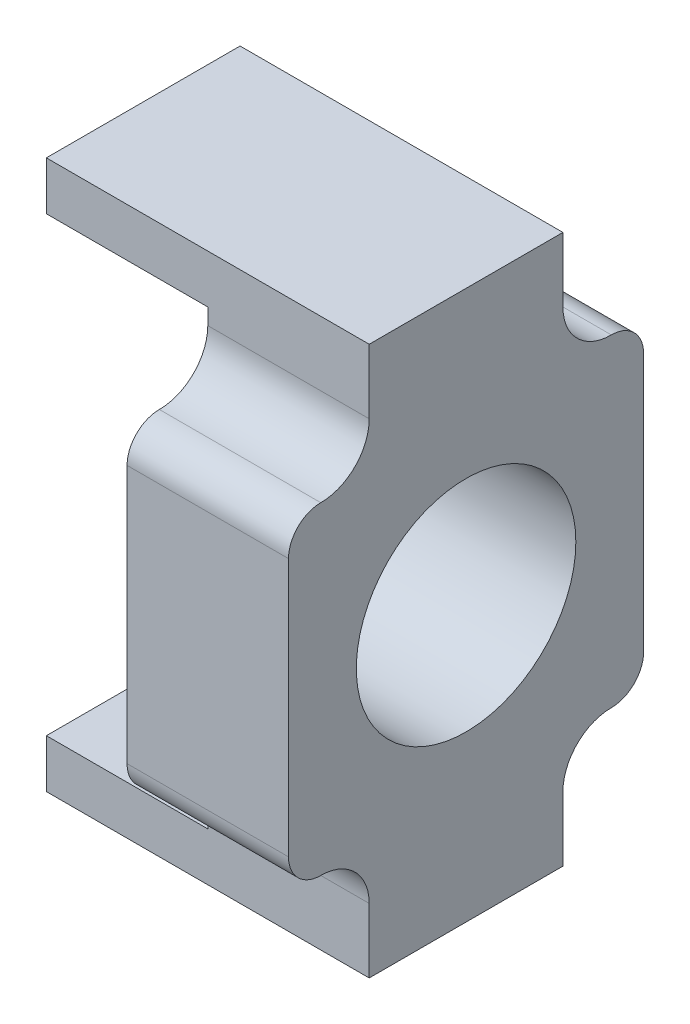
from build123d import *

# Parameters (mm, degrees)
SKETCH1_R           = 3.4
BOSS_EXTRUDE1_DEPTH = 5
SKETCH3_W           = 6
SKETCH3_H           = 1.5
BOSS_EXTRUDE2_DEPTH = 5
FILLET2_R           = 1.5
FILLET3_R           = 1


with BuildPart() as part:
    # Sketch1 → Boss-Extrude1 (new body)
    with BuildSketch(Plane(origin=(0, 0, 0), x_dir=(0, 0, -1), z_dir=(1, 0, 0))):
        Polygon((2.5, 0), (8.5, 0), (8.5, 3.5), (11, 3.5), (11, 13.5), (8.5, 13.5), (8.5, 17), (2.5, 17), (2.5, 13.5), (0, 13.5), (0, 3.5), (2.5, 3.5), align=None)
        with Locations((5.5, 8.5)):
            Circle(SKETCH1_R, mode=Mode.SUBTRACT)
    extrude(amount=BOSS_EXTRUDE1_DEPTH)

    # Sketch3 → Boss-Extrude2 (add)
    with BuildSketch(Plane.ZY):
        with Locations((-5.5, 16.25)):
            Rectangle(SKETCH3_W, SKETCH3_H)
        with Locations((-5.5, 0.75)):
            Rectangle(SKETCH3_W, SKETCH3_H)
    extrude(amount=BOSS_EXTRUDE2_DEPTH)

    # Fillet2
    fillet2_edges = [part.edges().sort_by_distance(p)[0] for p in [
        (2.5, 13.5, -8.5),
        (2.5, 13.5, -2.5),
        (2.5, 3.5, -2.5),
        (2.5, 3.5, -8.5),
    ]]
    fillet(fillet2_edges, radius=FILLET2_R)

    # Fillet3
    fillet3_edges = [part.edges().sort_by_distance(p)[0] for p in [
        (2.5, 3.5, -11),
        (2.5, 3.5, 0),
        (2.5, 13.5, 0),
        (2.5, 13.5, -11),
    ]]
    fillet(fillet3_edges, radius=FILLET3_R - 0.0001)  # a hair under: the kernel refuses the full size


solid = part.part
